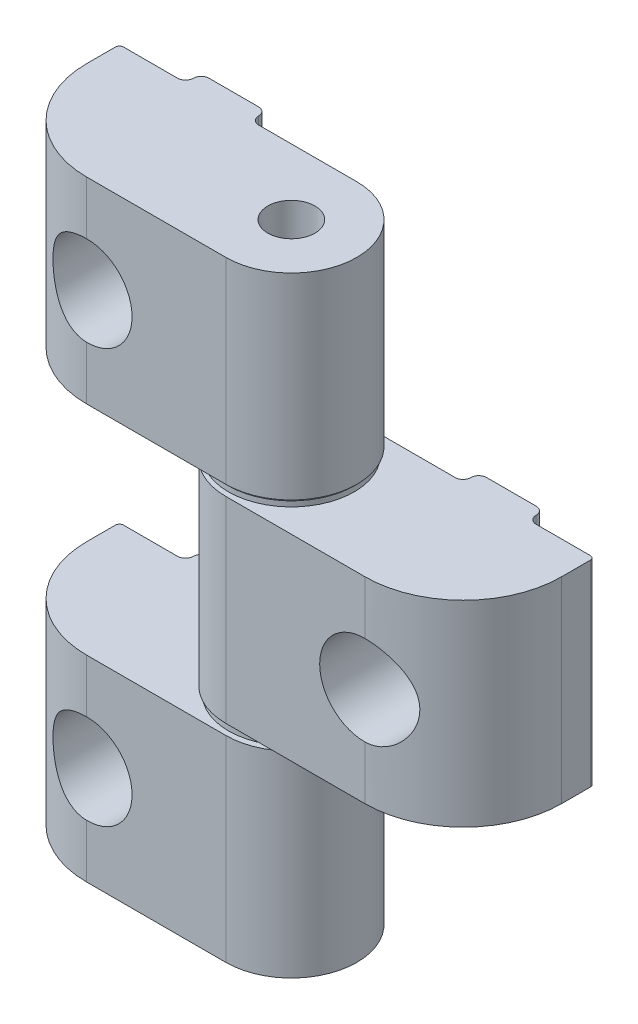
from build123d import *

# Parameters (mm, degrees)
SKETCH1_R               = 2.286
BOSS_EXTRUDE1_DEPTH     = 9.525
CUT_EXTRUDE1_DEPTH      = 32.130920172
CUT_EXTRUDE1_DEPTH_BACK = 32.130920172
SKETCH3_R               = 2.4892
SKETCH5_R               = 4.3434
CUT_EXTRUDE2_DEPTH      = 7.1501


with BuildPart() as part:
    # Sketch1 → Boss-Extrude1 (new, symmetric)
    with BuildSketch(Plane(origin=(0, 0, 0), x_dir=(1, 0, 0), z_dir=(0, 1, 0))):
        with BuildLine():
            Line((0, -6.35), (13.4874, -6.35))
            ThreePointArc((13.4874, -6.35), (20.222592091, -3.560192091), (23.0124, 3.175))
            Line((23.0124, 3.175), (23.0124, 5.969))
            ThreePointArc((23.0124, 5.969), (22.900807684, 6.238407684), (22.6314, 6.35))
            Line((22.6314, 6.35), (17.3736, 6.35))
            ThreePointArc((17.3736, 6.35), (16.834784633, 6.573184633), (16.6116, 7.112))
            ThreePointArc((16.6116, 7.112), (16.388415367, 7.650815367), (15.8496, 7.874))
            Line((15.8496, 7.874), (11.049, 7.874))
            ThreePointArc((11.049, 7.874), (10.510184633, 7.650815367), (10.287, 7.112))
            ThreePointArc((10.287, 7.112), (10.063815367, 6.573184633), (9.525, 6.35))
            Line((9.525, 6.35), (0, 6.35))
            ThreePointArc((0, 6.35), (-6.35, 0), (0, -6.35))
        make_face()
        Circle(SKETCH1_R, mode=Mode.SUBTRACT)
    extrude(amount=BOSS_EXTRUDE1_DEPTH, both=True)

    # Sketch3 → Cut-Extrude1 (cut, two sides: drawn at the far end of the back side and taken through both)
    with BuildSketch(Plane.XY.offset(-CUT_EXTRUDE1_DEPTH_BACK)):
        with Locations((13.4366, 0)):
            Circle(SKETCH3_R)
    extrude(amount=CUT_EXTRUDE1_DEPTH + CUT_EXTRUDE1_DEPTH_BACK, mode=Mode.SUBTRACT)

    # Sketch5 → Cut-Extrude2 (cut)
    with BuildSketch(Plane.XY.offset(6.35)):
        with Locations((13.4366, 0)):
            Circle(SKETCH5_R)
    extrude(amount=-CUT_EXTRUDE2_DEPTH, mode=Mode.SUBTRACT)


with BuildPart() as body_2:
    # Sketch2 → Revolve1 (revolve)
    with BuildSketch(Plane.XY):
        Polygon((0, 19.431), (0, -19.431), (-1.778, -19.431), (-2.286, -18.923), (-2.286, -10.287), (-6.096, -10.287), (-6.096, -9.779), (-2.286, -9.779), (-2.286, 9.779), (-6.096, 9.779), (-6.096, 10.287), (-2.286, 10.287), (-2.286, 18.923), (-1.778, 19.431), align=None)
    revolve(axis=Axis((0, 19.431, 0), (0, -1, 0)))


with BuildPart() as body_3:
    # Body-Move/Copy1: copy of part
    add(part.part.moved(Location((0, 20.066, 0))))


with BuildPart() as body_4:
    # Body-Move/Copy2: copy of part
    add(part.part.moved(Location((0, -20.066, 0))))


with BuildPart() as body_5:
    # Mirror1: mirrored copy
    add(body_3.part.mirror(Plane(origin=(0, 0, 0), x_dir=(0, 0, 1), z_dir=(1, 0, 0))))


with BuildPart() as body_6:
    # Mirror1 2: mirrored copy
    add(body_4.part.mirror(Plane(origin=(0, 0, 0), x_dir=(0, 0, 1), z_dir=(1, 0, 0))))


solid = Compound([part.part, body_2.part, body_5.part, body_6.part])
